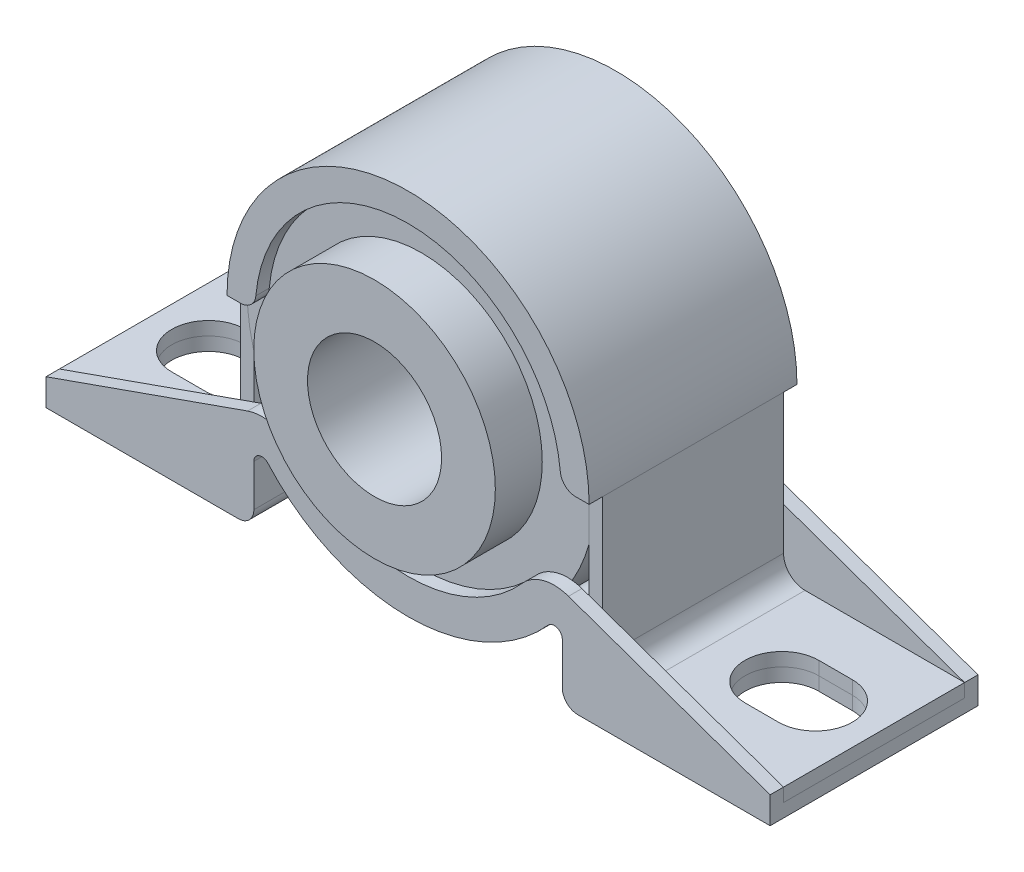
from build123d import *

# Parameters (mm, degrees)
EXTRUDE_THIN2_DEPTH  = 12.303125
EXTRUDE1_DEPTH       = 1.5875
EXTRUDE_THIN3_START  = -10.715625
EXTRUDE_THIN3_DEPTH  = 21.43125
EXTRUDE2_DEPTH       = 1.5875
EXTRUDE3_START       = -10.715625
EXTRUDE3_OUTLINE_R   = 20.6375
EXTRUDE3_OUTLINE_R_2 = 14.3002
EXTRUDE3_DEPTH       = 21.43125
SKETCH8_R            = 14.3002
SKETCH8_R_2          = 7.9375
EXTRUDE4_DEPTH       = 21.99894
CUT_EXTRUDE1_DEPTH   = 51.950156499


# Read off the part's stored shape, not the designer's step: Extrude-Thin3, Extrude3
with BuildPart() as part:
    # Sketch1 → Extrude-Thin2 (new, symmetric)
    with BuildSketch(Plane.XY):
        with BuildLine():
            Line((-42.8625, -20.6375), (-20.09775, -20.6375))
            ThreePointArc((-20.09775, -20.6375), (-19.918144878, -20.563105122), (-19.84375, -20.3835))
            Line((-19.84375, -20.3835), (-19.84375, -15.420011096))
            ThreePointArc((-19.84375, -15.420011096), (-18.207905551, -13.0463846), (-15.40744863, -13.730146866))
            ThreePointArc((-15.40744863, -13.730146866), (0, -20.6375), (15.40744863, -13.730146866))
            ThreePointArc((15.40744863, -13.730146866), (18.207905551, -13.0463846), (19.84375, -15.420011096))
            Line((19.84375, -15.420011096), (19.84375, -20.3835))
            ThreePointArc((19.84375, -20.3835), (19.918144878, -20.563105122), (20.09775, -20.6375))
            Line((20.09775, -20.6375), (42.8625, -20.6375))
            Line((42.8625, -20.6375), (42.8625, -22.225))
            Line((42.8625, -22.225), (20.09775, -22.225))
            ThreePointArc((20.09775, -22.225), (18.795612862, -21.685637138), (18.25625, -20.3835))
            Line((18.25625, -20.3835), (18.25625, -15.420011096))
            ThreePointArc((18.25625, -15.420011096), (17.642808332, -14.52990116), (16.592636986, -14.786312009))
            ThreePointArc((16.592636986, -14.786312009), (0, -22.225), (-16.592636986, -14.786312009))
            ThreePointArc((-16.592636986, -14.786312009), (-17.642808332, -14.52990116), (-18.25625, -15.420011096))
            Line((-18.25625, -15.420011096), (-18.25625, -20.3835))
            ThreePointArc((-18.25625, -20.3835), (-18.795612862, -21.685637138), (-20.09775, -22.225))
            Line((-20.09775, -22.225), (-42.8625, -22.225))
            Line((-42.8625, -22.225), (-42.8625, -20.6375))
        make_face()
    extrude(amount=EXTRUDE_THIN2_DEPTH, both=True)

    # Sketch4 → Extrude1 (add)
    with BuildSketch(Plane.XY.offset(12.303125)):
        with BuildLine():
            Line((-42.8625, -19.05), (-18.993828558, -10.629391671))
            ThreePointArc((-18.993828558, -10.629391671), (-16.037730525, -10.500296197), (-13.51114726, -12.040282636))
            ThreePointArc((-13.51114726, -12.040282636), (0, -18.0975), (13.51114726, -12.040282636))
            ThreePointArc((13.51114726, -12.040282636), (16.037730525, -10.500296197), (18.993828558, -10.629391671))
            Line((18.993828558, -10.629391671), (42.8625, -19.05))
            Line((42.8625, -19.05), (42.8625, -22.225))
            Line((42.8625, -22.225), (20.09775, -22.225))
            ThreePointArc((20.09775, -22.225), (18.795612862, -21.685637138), (18.25625, -20.3835))
            Line((18.25625, -20.3835), (18.25625, -15.420011096))
            ThreePointArc((18.25625, -15.420011096), (17.642808332, -14.52990116), (16.592636986, -14.786312009))
            ThreePointArc((16.592636986, -14.786312009), (0, -22.225), (-16.592636986, -14.786312009))
            ThreePointArc((-16.592636986, -14.786312009), (-17.642808332, -14.52990116), (-18.25625, -15.420011096))
            Line((-18.25625, -15.420011096), (-18.25625, -20.3835))
            ThreePointArc((-18.25625, -20.3835), (-18.795612862, -21.685637138), (-20.09775, -22.225))
            Line((-20.09775, -22.225), (-42.8625, -22.225))
            Line((-42.8625, -22.225), (-42.8625, -19.05))
        make_face()
    extrude1 = extrude(amount=-EXTRUDE1_DEPTH)

    # Mirror1: Extrude1 across plane
    add(extrude1.mirror(Plane.XY))


with BuildPart() as body_2:
    # Extrude-Thin3 outline → Extrude-Thin3 (new body)
    with BuildSketch(Plane.XY.offset(EXTRUDE_THIN3_START)):
        with BuildLine():
            Line((-23.97125, -19.05), (-42.8625, -19.05))
            Line((-42.8625, -19.05), (-42.8625, -20.6375))
            Line((-42.8625, -20.6375), (-23.97125, -20.6375))
            ThreePointArc((-23.97125, -20.6375), (-21.052666761, -19.428583239), (-19.84375, -16.51))
            Line((-19.84375, -16.51), (-19.84375, 0))
            ThreePointArc((-19.84375, 0), (0, 19.84375), (19.84375, 0))
            Line((19.84375, 0), (19.84375, -16.51))
            ThreePointArc((19.84375, -16.51), (21.052666761, -19.428583239), (23.97125, -20.6375))
            Line((23.97125, -20.6375), (42.8625, -20.6375))
            Line((42.8625, -20.6375), (42.8625, -19.05))
            Line((42.8625, -19.05), (23.97125, -19.05))
            ThreePointArc((23.97125, -19.05), (22.175198776, -18.306051224), (21.43125, -16.51))
            Line((21.43125, -16.51), (21.43125, 0))
            ThreePointArc((21.43125, 0), (0, 21.43125), (-21.43125, 0))
            Line((-21.43125, 0), (-21.43125, -16.51))
            ThreePointArc((-21.43125, -16.51), (-22.175198776, -18.306051224), (-23.97125, -19.05))
        make_face()
    extrude(amount=EXTRUDE_THIN3_DEPTH)

    # Sketch6 → Extrude2 (add)
    with BuildSketch(Plane(origin=(0, 0, -10.715625), x_dir=(-1, 0, 0), z_dir=(0, 0, -1))):
        with BuildLine():
            Line((-19.84375, 0), (-21.43125, 0))
            ThreePointArc((-21.43125, 0), (0, 21.43125), (21.43125, 0))
            Line((21.43125, 0), (19.84375, 0))
            ThreePointArc((19.84375, 0), (18.610270538, 0.477999494), (18.020989833, 1.662357273))
            ThreePointArc((18.020989833, 1.662357273), (0, 18.0975), (-18.020989833, 1.662357273))
            ThreePointArc((-18.020989833, 1.662357273), (-18.610270538, 0.477999494), (-19.84375, 0))
        make_face()
    extrude2 = extrude(amount=EXTRUDE2_DEPTH)

    # Mirror2: Extrude2 across plane
    add(extrude2.mirror(Plane.XY))


with BuildPart() as body_3:
    # Extrude3 outline → Extrude3 (new body)
    with BuildSketch(Plane.XY.offset(EXTRUDE3_START)):
        Circle(EXTRUDE3_OUTLINE_R)
        Circle(EXTRUDE3_OUTLINE_R_2, mode=Mode.SUBTRACT)
    extrude(amount=EXTRUDE3_DEPTH)


with BuildPart() as body_4:
    # Sketch8 → Extrude4 (new body)
    with BuildSketch(Plane.XY.offset(16.271875)):
        Circle(SKETCH8_R)
        Circle(SKETCH8_R_2, mode=Mode.SUBTRACT)
    extrude(amount=-EXTRUDE4_DEPTH)


with BuildPart() as cut_extrude1_tool:
    # Sketch3 → Cut-Extrude1 (new, through all)
    with BuildSketch(Plane(origin=(0, 0, 0), x_dir=(1, 0, 0), z_dir=(0, 1, 0))):
        with BuildLine():
            Line((-35.9171875, 4.365625), (-31.9484375, 4.365625))
            ThreePointArc((-31.9484375, 4.365625), (-27.5828125, 0), (-31.9484375, -4.365625))
            Line((-31.9484375, -4.365625), (-35.9171875, -4.365625))
            ThreePointArc((-35.9171875, -4.365625), (-40.2828125, 0), (-35.9171875, 4.365625))
        make_face()
        with BuildLine():
            Line((31.9484375, -4.365625), (35.9171875, -4.365625))
            ThreePointArc((35.9171875, -4.365625), (40.2828125, 0), (35.9171875, 4.365625))
            Line((35.9171875, 4.365625), (31.9484375, 4.365625))
            ThreePointArc((31.9484375, 4.365625), (27.5828125, 0), (31.9484375, -4.365625))
        make_face()
    extrude(amount=-CUT_EXTRUDE1_DEPTH)


with BuildPart() as part_1:
    add(part.part)

    # Cut-Extrude1: cut by cut_extrude1_tool
    add(cut_extrude1_tool.part, mode=Mode.SUBTRACT)


with BuildPart() as body_2_1:
    add(body_2.part)

    # Cut-Extrude1: cut by cut_extrude1_tool
    add(cut_extrude1_tool.part, mode=Mode.SUBTRACT)


solid = Compound([body_3.part, body_4.part, part_1.part, body_2_1.part])
